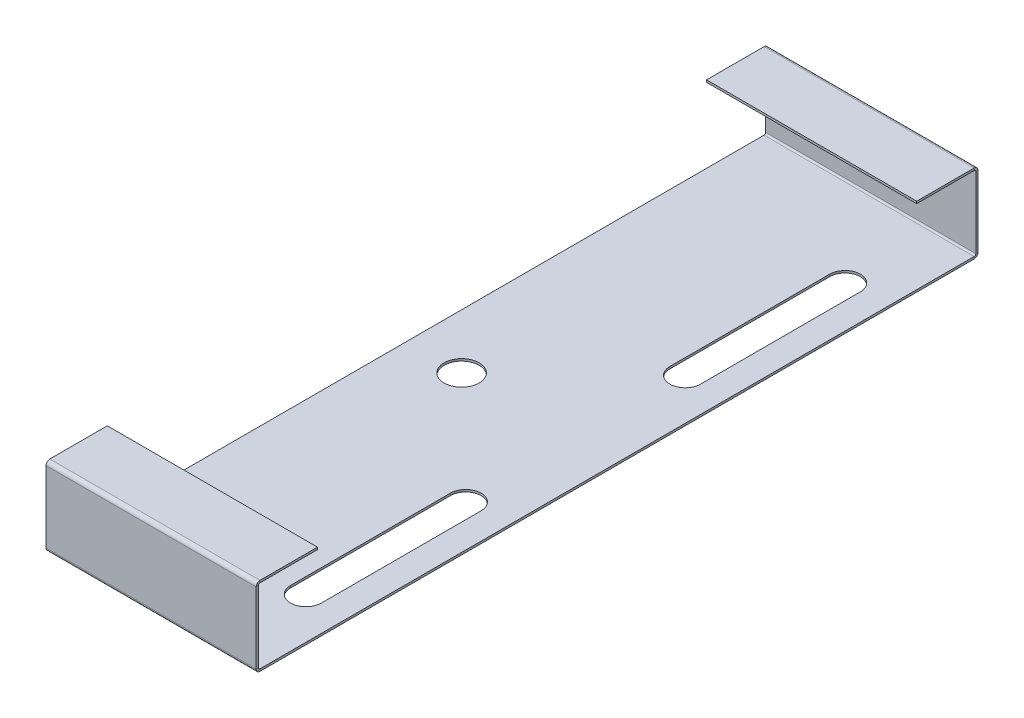
from build123d import *

# Parameters (mm, degrees)
SKETCH1_W                    = 96
SKETCH1_H                    = 1
BASE_FLANGE1_DEPTH           = 329.72
EDGE_FLANGE1_STRIP_W         = 5.4732
EDGE_FLANGE1_STRIP_H         = 1
EDGE_FLANGE1_STRIP_CUT_DEPTH = 96
EDGE_FLANGE1_DEPTH           = 96
EDGE_FLANGE2_STRIP_W         = 5.4732
EDGE_FLANGE2_STRIP_H         = 1
EDGE_FLANGE2_STRIP_CUT_DEPTH = 96
EDGE_FLANGE2_DEPTH           = 96
EDGE_FLANGE3_STRIP_W         = 5.4732
EDGE_FLANGE3_STRIP_H         = 1
EDGE_FLANGE3_STRIP_CUT_DEPTH = 96
EDGE_FLANGE3_DEPTH           = 96
EDGE_FLANGE4_STRIP_W         = 5.4732
EDGE_FLANGE4_STRIP_H         = 1
EDGE_FLANGE4_STRIP_CUT_DEPTH = 96
EDGE_FLANGE4_DEPTH           = 96
CUT_EXTRUDE1_DEPTH           = 10
SKETCH23_R                   = 8
CUT_EXTRUDE4_DEPTH           = 10


# Sheet-metal steps are written as plain solids
with BuildPart() as part:
    # Sketch1 → Base-Flange1 (new body)
    with BuildSketch(Plane.XY):
        with Locations((48, -0.5)):
            Rectangle(SKETCH1_W, SKETCH1_H)
    extrude(amount=BASE_FLANGE1_DEPTH)

    # Edge-Flange1 strip (across the edge) → Edge-Flange1 strip cut (cut)
    with BuildSketch(Plane(origin=(0, 0, 329.72), x_dir=(0, 0, -1), z_dir=(1, 0, 0))):
        with Locations((-1, -0.5)):
            Rectangle(EDGE_FLANGE1_STRIP_W, EDGE_FLANGE1_STRIP_H)
    extrude(amount=EDGE_FLANGE1_STRIP_CUT_DEPTH, mode=Mode.SUBTRACT)

    # Edge-Flange1 section (across the edge) → Edge-Flange1 (add)
    with BuildSketch(Plane(origin=(0, 0, 329.72), x_dir=(0, 0, -1), z_dir=(1, 0, 0))):
        with BuildLine():
            Line((0, 0.7366), (0, 35))
            Line((0, 35), (1, 35))
            Line((1, 35), (1, 0.7366))
            ThreePointArc((1, 0.7366), (1.215745145, 0.215745145), (1.7366, 0))
            Line((1.7366, 0), (1.7366, -1))
            ThreePointArc((1.7366, -1), (0.508638364, -0.491361636), (0, 0.7366))
        make_face()
    extrude(amount=EDGE_FLANGE1_DEPTH)

    # Edge-Flange2 strip (across the edge) → Edge-Flange2 strip cut (cut)
    with BuildSketch(Plane.ZY.offset(-96)):
        with Locations((-1, -0.5)):
            Rectangle(EDGE_FLANGE2_STRIP_W, EDGE_FLANGE2_STRIP_H)
    extrude(amount=EDGE_FLANGE2_STRIP_CUT_DEPTH, mode=Mode.SUBTRACT)

    # Edge-Flange2 section (across the edge) → Edge-Flange2 (add)
    with BuildSketch(Plane.ZY.offset(-96)):
        with BuildLine():
            Line((0, 0.7366), (0, 35))
            Line((0, 35), (1, 35))
            Line((1, 35), (1, 0.7366))
            ThreePointArc((1, 0.7366), (1.215745145, 0.215745145), (1.7366, 0))
            Line((1.7366, 0), (1.7366, -1))
            ThreePointArc((1.7366, -1), (0.508638364, -0.491361636), (0, 0.7366))
        make_face()
    extrude(amount=EDGE_FLANGE2_DEPTH)

    # Edge-Flange3 strip (across the edge) → Edge-Flange3 strip cut (cut)
    with BuildSketch(Plane(origin=(0, 35, 328.72), x_dir=(0, -1, 0), z_dir=(1, 0, 0))):
        with Locations((-1, -0.5)):
            Rectangle(EDGE_FLANGE3_STRIP_W, EDGE_FLANGE3_STRIP_H)
    extrude(amount=EDGE_FLANGE3_STRIP_CUT_DEPTH, mode=Mode.SUBTRACT)

    # Edge-Flange3 section (across the edge) → Edge-Flange3 (add)
    with BuildSketch(Plane(origin=(0, 35, 328.72), x_dir=(0, -1, 0), z_dir=(1, 0, 0))):
        with BuildLine():
            Line((0, 0.7366), (0, 27))
            Line((0, 27), (1, 27))
            Line((1, 27), (1, 0.7366))
            ThreePointArc((1, 0.7366), (1.215745145, 0.215745145), (1.7366, 0))
            Line((1.7366, 0), (1.7366, -1))
            ThreePointArc((1.7366, -1), (0.508638364, -0.491361636), (0, 0.7366))
        make_face()
    extrude(amount=EDGE_FLANGE3_DEPTH)

    # Edge-Flange4 strip (across the edge) → Edge-Flange4 strip cut (cut)
    with BuildSketch(Plane(origin=(96, 35, 1), x_dir=(0, -1, 0), z_dir=(-1, 0, 0))):
        with Locations((-1, -0.5)):
            Rectangle(EDGE_FLANGE4_STRIP_W, EDGE_FLANGE4_STRIP_H)
    extrude(amount=EDGE_FLANGE4_STRIP_CUT_DEPTH, mode=Mode.SUBTRACT)

    # Edge-Flange4 section (across the edge) → Edge-Flange4 (add)
    with BuildSketch(Plane(origin=(96, 35, 1), x_dir=(0, -1, 0), z_dir=(-1, 0, 0))):
        with BuildLine():
            Line((0, 0.7366), (0, 27))
            Line((0, 27), (1, 27))
            Line((1, 27), (1, 0.7366))
            ThreePointArc((1, 0.7366), (1.215745145, 0.215745145), (1.7366, 0))
            Line((1.7366, 0), (1.7366, -1))
            ThreePointArc((1.7366, -1), (0.508638364, -0.491361636), (0, 0.7366))
        make_face()
    extrude(amount=EDGE_FLANGE4_DEPTH)

    # Sketch22 → Cut-Extrude1 (cut)
    with BuildSketch(Plane(origin=(0, 0, 0), x_dir=(1, 0, 0), z_dir=(0, 1, 0))):
        with BuildLine():
            Line((70, -214.9834), (70, -287.9834))
            ThreePointArc((70, -287.9834), (77, -294.9834), (84, -287.9834))
            Line((84, -287.9834), (84, -214.9834))
            ThreePointArc((84, -214.9834), (77, -207.9834), (70, -214.9834))
        make_face()
        with BuildLine():
            Line((70, -114.7366), (70, -41.7366))
            ThreePointArc((70, -41.7366), (77, -34.7366), (84, -41.7366))
            Line((84, -41.7366), (84, -114.7366))
            ThreePointArc((84, -114.7366), (77, -121.7366), (70, -114.7366))
        make_face()
    extrude(amount=-CUT_EXTRUDE1_DEPTH, mode=Mode.SUBTRACT)

    # Sketch23 → Cut-Extrude4 (cut)
    with BuildSketch(Plane(origin=(0, 0, 0), x_dir=(1, 0, 0), z_dir=(0, 1, 0))):
        with Locations(Location((25, -164.86, 0), (0, 0, 270))):
            Circle(SKETCH23_R)
    extrude(amount=-CUT_EXTRUDE4_DEPTH, mode=Mode.SUBTRACT)


solid = part.part
